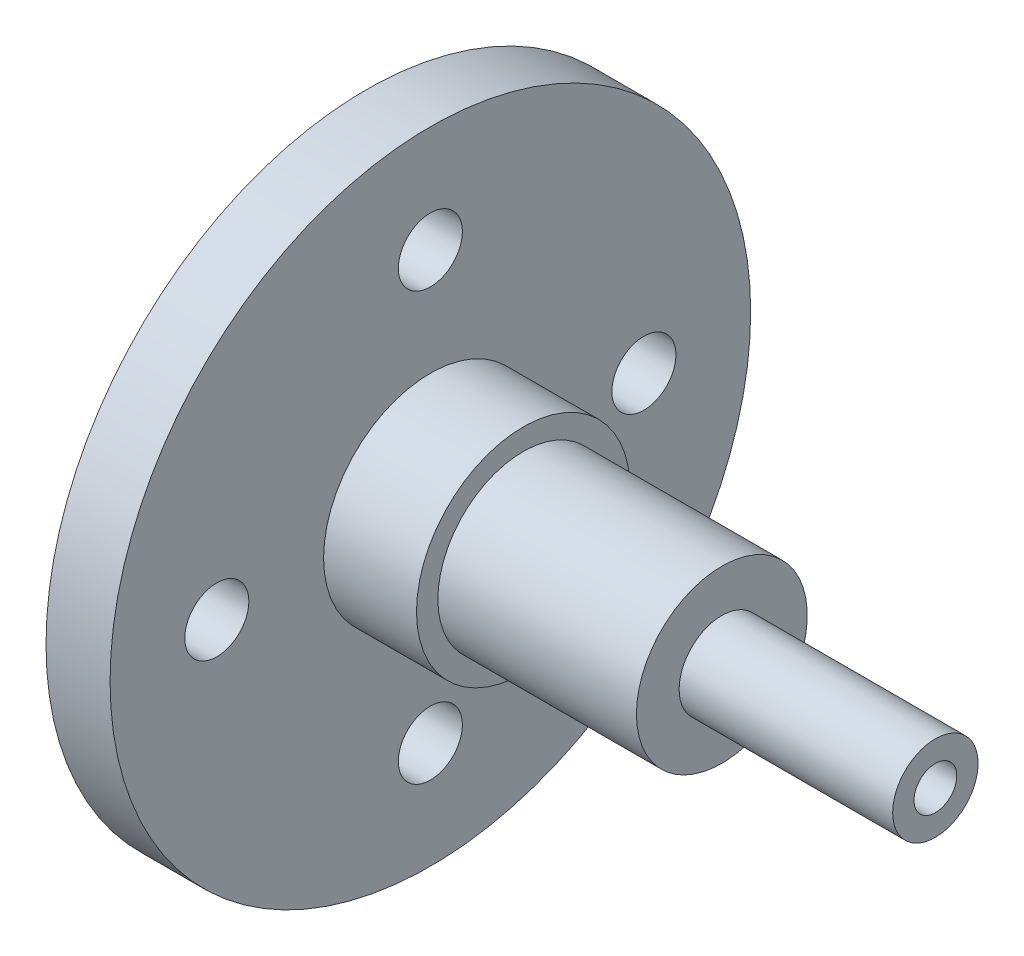
from build123d import *

# Parameters (mm, degrees)
SKETCH2_R          = 1.5
CUT_EXTRUDE1_DEPTH = 32.769836323


with BuildPart() as part:
    # Sketch1 → Revolve1 (revolve)
    with BuildSketch(Plane.XY):
        Polygon((-13.325, 1), (-13.325, 15), (-10.325, 15), (-10.325, 5), (-5.975, 5), (-5.975, 4), (3.325, 4), (3.325, 2), (13.325, 2), (13.325, 1), align=None)
    revolve(axis=Axis((-13.325, 0, 0), (1, 0, 0)))

    # Sketch2 → Cut-Extrude1 (cut, through all)
    with BuildSketch(Plane(origin=(-10.325, 0, 0), x_dir=(0, 0, -1), z_dir=(1, 0, 0))):
        with Locations((0, 10)):
            Circle(SKETCH2_R)
        with Locations((10, 0)):
            Circle(SKETCH2_R)
        with Locations((0, -10)):
            Circle(SKETCH2_R)
        with Locations((-10, 0)):
            Circle(SKETCH2_R)
    extrude(amount=-CUT_EXTRUDE1_DEPTH, mode=Mode.SUBTRACT)


solid = part.part
